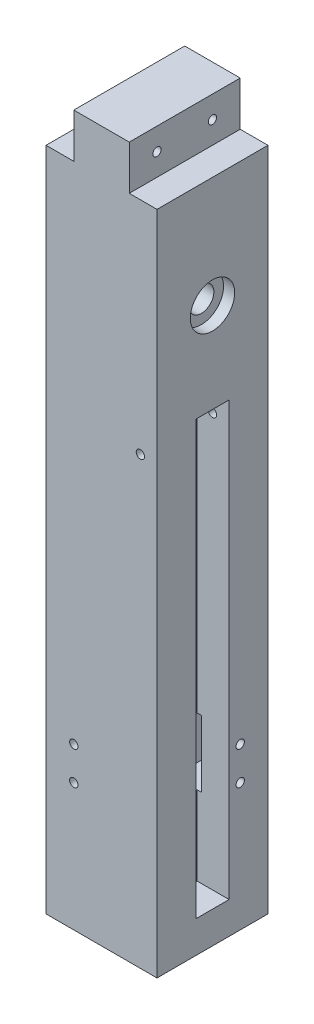
from build123d import *

# Parameters (mm, degrees)
BOSS_EXTRUDE1_DEPTH = 127
SKETCH2_R           = 14.2875
SKETCH2_R_2         = 4.7625
CUT_EXTRUDE1_DEPTH  = 468.663597044
SKETCH3_W           = 31.75
SKETCH3_H           = 76.2
CUT_EXTRUDE2_DEPTH  = 63.5
SKETCH2_3_R         = 25.4
SKETCH2_3_R_2       = 14.2875
CUT_EXTRUDE3_DEPTH  = 12.7
SKETCH4_R           = 4.7625
CUT_EXTRUDE4_DEPTH  = 69.85
SKETCH5_W           = 31.75
SKETCH5_H           = 76.2
CUT_EXTRUDE6_DEPTH  = 63.246
SKETCH6_R           = 4.7625
CUT_EXTRUDE7_DEPTH  = 69.85
SKETCH7_W           = 38.1
SKETCH7_H           = 495.3
CUT_EXTRUDE8_DEPTH  = 36.5125
SKETCH8_R           = 4.7625
CUT_EXTRUDE9_DEPTH  = 455.546466272


with BuildPart() as part:
    # Sketch1 → Boss-Extrude1 (new body)
    with BuildSketch(Plane.XY):
        Polygon((63.5, -381), (63.5, 381), (31.75, 381), (31.75, 431.8), (-31.75, 431.8), (-31.75, 381), (-63.5, 381), (-63.5, -381), align=None)
    extrude(amount=BOSS_EXTRUDE1_DEPTH)

    # Sketch2 → Cut-Extrude1 (cut, through all)
    with BuildSketch(Plane(origin=(63.5, 0, 0), x_dir=(0, 0, -1), z_dir=(1, 0, 0))):
        with Locations((-63.5, 254)):
            Circle(SKETCH2_R)
        with Locations((-95.25, 406.4)):
            Circle(SKETCH2_R_2)
        with Locations((-31.75, 406.4)):
            Circle(SKETCH2_R_2)
    extrude(amount=-CUT_EXTRUDE1_DEPTH, mode=Mode.SUBTRACT)

    # Sketch3 → Cut-Extrude2 (cut)
    with BuildSketch(Plane(origin=(0, 0, 0), x_dir=(-1, 0, 0), z_dir=(0, 0, -1))):
        with Locations((-15.875, -215.9)):
            Rectangle(SKETCH3_W, SKETCH3_H)
    extrude(amount=-CUT_EXTRUDE2_DEPTH, mode=Mode.SUBTRACT)

    # Sketch2<3> → Cut-Extrude3 (cut)
    with BuildSketch(Plane(origin=(63.5, 0, 0), x_dir=(0, 0, -1), z_dir=(1, 0, 0))):
        with Locations((-63.5, 254)):
            Circle(SKETCH2_3_R)
        with Locations((-63.5, 254)):
            Circle(SKETCH2_3_R_2, mode=Mode.SUBTRACT)
    extrude(amount=-CUT_EXTRUDE3_DEPTH, mode=Mode.SUBTRACT)

    # Sketch4 → Cut-Extrude4 (cut)
    with BuildSketch(Plane(origin=(63.5, 0, 0), x_dir=(0, 0, -1), z_dir=(1, 0, 0))):
        with Locations((-31.75, -196.85)):
            Circle(SKETCH4_R)
        with Locations((-31.75, -234.95)):
            Circle(SKETCH4_R)
    extrude(amount=-CUT_EXTRUDE4_DEPTH, mode=Mode.SUBTRACT)

    # Sketch5 → Cut-Extrude6 (cut)
    with BuildSketch(Plane.ZY.offset(63.5)):
        with Locations((79.375, -215.9)):
            Rectangle(SKETCH5_W, SKETCH5_H)
    extrude(amount=-CUT_EXTRUDE6_DEPTH, mode=Mode.SUBTRACT)

    # Sketch6 → Cut-Extrude7 (cut)
    with BuildSketch(Plane.XY.offset(127)):
        with Locations((-31.75, -196.85)):
            Circle(SKETCH6_R)
        with Locations((-31.75, -234.95)):
            Circle(SKETCH6_R)
    extrude(amount=-CUT_EXTRUDE7_DEPTH, mode=Mode.SUBTRACT)

    # Sketch7 → Cut-Extrude8 (cut)
    with BuildSketch(Plane(origin=(63.5, 0, 0), x_dir=(0, 0, -1), z_dir=(1, 0, 0))):
        with Locations((-63.5, -96.8375)):
            Rectangle(SKETCH7_W, SKETCH7_H)
    extrude(amount=-CUT_EXTRUDE8_DEPTH, mode=Mode.SUBTRACT)

    # Sketch8 → Cut-Extrude9 (cut, through all)
    with BuildSketch(Plane(origin=(0, 0, 0), x_dir=(-1, 0, 0), z_dir=(0, 0, -1))):
        with Locations((-44.45, 128.5875)):
            Circle(SKETCH8_R)
    extrude(amount=-CUT_EXTRUDE9_DEPTH, mode=Mode.SUBTRACT)


solid = part.part
